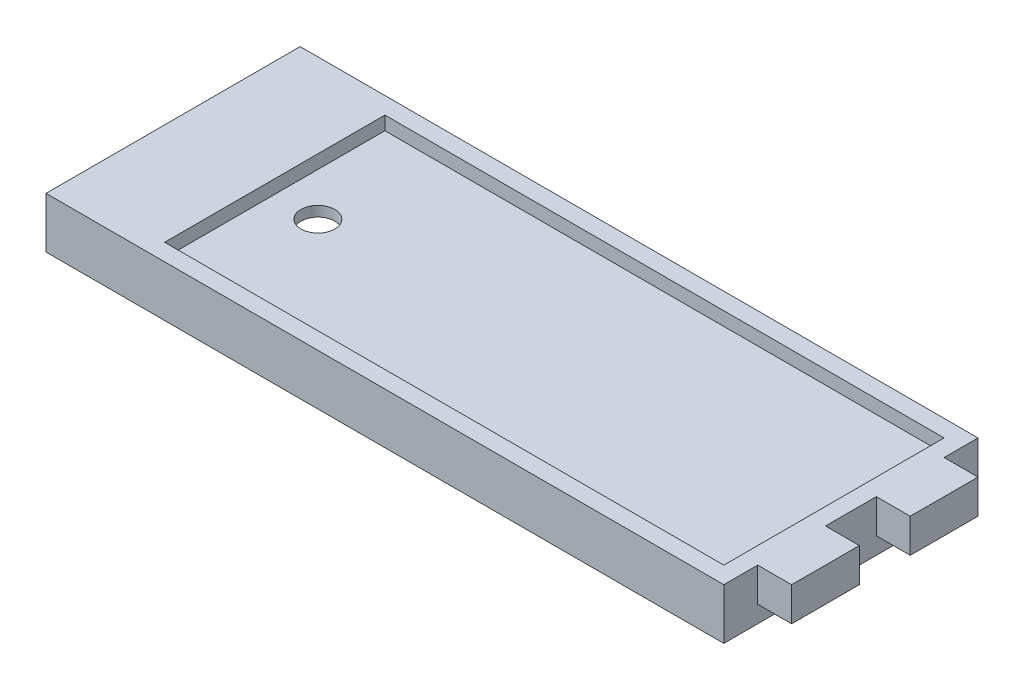
from build123d import *

# Parameters (mm, degrees)
SKETCH1_W           = 200
SKETCH1_H           = 75
BOSS_EXTRUDE1_DEPTH = 15
SKETCH9_W           = 165
SKETCH9_H           = 65
CUT_EXTRUDE5_DEPTH  = 4
SHELL3_START        = -34.5
SHELL3_DEPTH        = 69
SKETCH14_W          = 20
SKETCH14_H          = 10
BOSS_EXTRUDE5_DEPTH = 10
SKETCH15_R          = 5
CUT_EXTRUDE7_DEPTH  = 156.007257895


# Read off the part's stored shape, not the designer's step: Shell3
with BuildPart() as part:
    # Sketch1 → Boss-Extrude1 (new body)
    with BuildSketch(Plane(origin=(0, 0, 0), x_dir=(1, 0, 0), z_dir=(0, 1, 0))):
        with Locations((40, 0)):
            Rectangle(SKETCH1_W, SKETCH1_H)
    extrude(amount=BOSS_EXTRUDE1_DEPTH)

    # Sketch9 → Cut-Extrude5 (cut)
    with BuildSketch(Plane(origin=(0, 15, 0), x_dir=(1, 0, 0), z_dir=(0, 1, 0))):
        with Locations((52.5, 0)):
            Rectangle(SKETCH9_W, SKETCH9_H)
    extrude(amount=-CUT_EXTRUDE5_DEPTH, mode=Mode.SUBTRACT)

    # Shell3 outline → Shell3 (cut)
    with BuildSketch(Plane.XY.offset(SHELL3_START)):
        Polygon((137, 0), (137, 8), (-33, 8), (-33, 12), (-60, 12), (-60, 0), align=None)
    extrude(amount=SHELL3_DEPTH, mode=Mode.SUBTRACT)

    # Sketch14 → Boss-Extrude5 (add)
    with BuildSketch(Plane(origin=(140, 0, 0), x_dir=(0, 0, -1), z_dir=(1, 0, 0))):
        with Locations((-17.5, 10)):
            Rectangle(SKETCH14_W, SKETCH14_H)
        with Locations((17.5, 10)):
            Rectangle(SKETCH14_W, SKETCH14_H)
    extrude(amount=BOSS_EXTRUDE5_DEPTH)

    # Sketch15 → Cut-Extrude7 (cut, through all)
    with BuildSketch(Plane(origin=(0, 11, 0), x_dir=(1, 0, 0), z_dir=(0, 1, 0))):
        with Locations(Location((-17.28231035, 0, 0), (0, 0, 270))):
            Circle(SKETCH15_R)
    extrude(amount=-CUT_EXTRUDE7_DEPTH, mode=Mode.SUBTRACT)


solid = part.part
